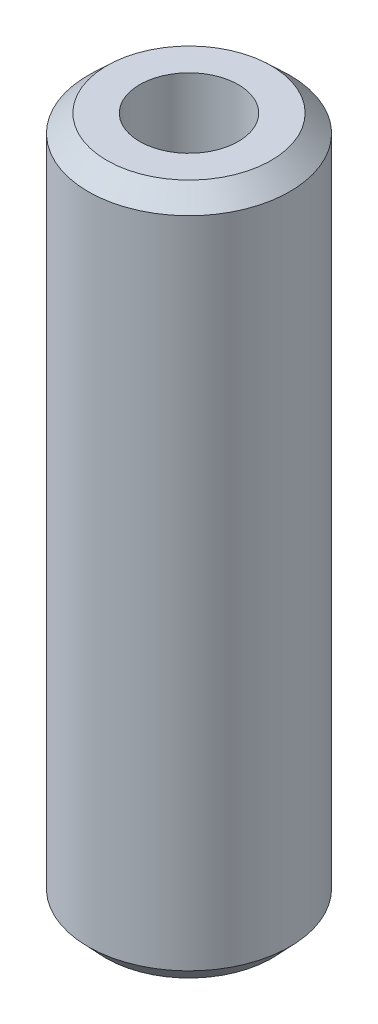
from build123d import *
from OCP.BRepFilletAPI import BRepFilletAPI_MakeChamfer

# Parameters (mm, degrees)
SKETCH1_R           = 15
BOSS_EXTRUDE1_DEPTH = 102.705654889
SKETCH2_R           = 7.337132329
CUT_EXTRUDE1_DEPTH  = 105.873502594
CHAMFER1_SIZE       = 2.629001726
CHAMFER1_SIZE2      = 2.781543895


with BuildPart() as part:
    # Sketch1 → Boss-Extrude1 (new body)
    with BuildSketch(Plane(origin=(0, 0, 0), x_dir=(1, 0, 0), z_dir=(0, 1, 0))):
        Circle(SKETCH1_R)
    extrude(amount=BOSS_EXTRUDE1_DEPTH)

    # Sketch2 → Cut-Extrude1 (cut, through all)
    with BuildSketch(Plane(origin=(0, 0, 0), x_dir=(1, 0, 0), z_dir=(0, 1, 0))):
        Circle(SKETCH2_R)
    extrude(amount=CUT_EXTRUDE1_DEPTH, mode=Mode.SUBTRACT)

    # Chamfer1: one chamfer whose edges measure the first distance from different faces: ONE call of the kernel's chamfer builder (chamfer() names one face for all edges)
    chamfer1_edges_1 = [part.edges().sort_by_distance(p)[0] for p in [
        (-15, 102.705654889, 0),
    ]]
    chamfer1_side_1 = [part.faces().sort_by_distance(p)[0] for p in [
        (-15, 51.352827445, 0),
    ]]
    chamfer1_edges_2 = [part.edges().sort_by_distance(p)[0] for p in [
        (-15, 0, 0),
    ]]
    chamfer1_side_2 = [part.faces().sort_by_distance(p)[0] for p in [
        (-14.575735931, 0, 0),
    ]]
    chamfer1 = BRepFilletAPI_MakeChamfer(part.part.solid().wrapped)
    for e in chamfer1_edges_1:
        chamfer1.Add(CHAMFER1_SIZE, CHAMFER1_SIZE2, e.wrapped, chamfer1_side_1[0].wrapped)  # the first distance lies on this face
    for e in chamfer1_edges_2:
        chamfer1.Add(CHAMFER1_SIZE, CHAMFER1_SIZE2, e.wrapped, chamfer1_side_2[0].wrapped)  # the first distance lies on this face
    add(Compound.cast(chamfer1.Shape()), mode=Mode.REPLACE)


solid = part.part
